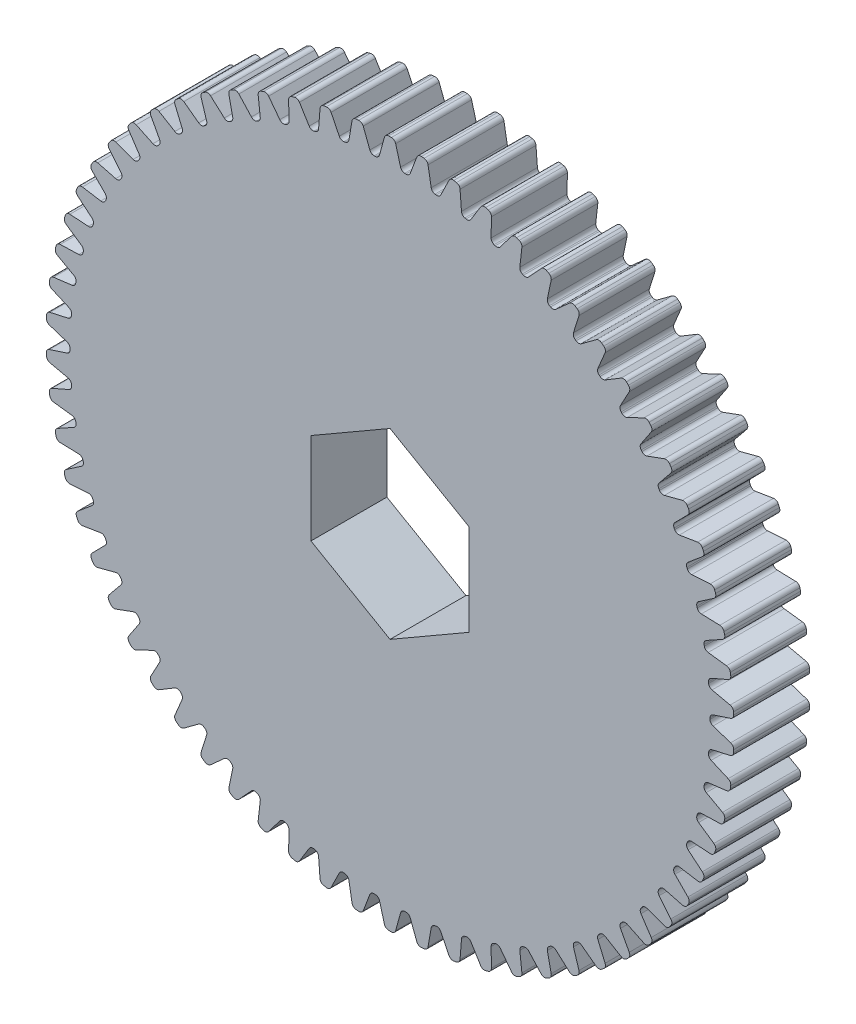
from build123d import *

# Parameters (mm, degrees)
SKETCH2_R           = 25.2838
BOSS_EXTRUDE1_DEPTH = 6
BOSS_EXTRUDE2_DEPTH = 6
CUT_EXTRUDE1_DEPTH  = 38.606243164
FILLET1_R           = 0.35
CIRPATTERN1_DEPTH   = 6


# Read off the part's stored shape, not the designer's step: CirPattern1
with BuildPart() as part:
    # Sketch2 → Boss-Extrude1 (new body)
    with BuildSketch(Plane.XY):
        Circle(SKETCH2_R)
    extrude(amount=BOSS_EXTRUDE1_DEPTH)

    # Sketch3 → Boss-Extrude2 (add)
    with BuildSketch(Plane.XY):
        with BuildLine():
            Line((-0.375, 27.181213318), (-0.9, 25.267776761))
            ThreePointArc((-0.9, 25.267776761), (0, 25.2838), (0.9, 25.267776761))
            Line((0.9, 25.267776761), (0.375, 27.181213318))
            ThreePointArc((0.375, 27.181213318), (0, 27.1838), (-0.375, 27.181213318))
        make_face()
    extrude(amount=BOSS_EXTRUDE2_DEPTH)

    # Sketch4 → Cut-Extrude1 (cut, through all)
    with BuildSketch(Plane(origin=(0, 0, 0), x_dir=(-1, 0, 0), z_dir=(0, 0, -1))):
        Polygon((-6.25, 3.608439182), (-6.25, -3.608439182), (0, -7.216878365), (6.25, -3.608439182), (6.25, 3.608439182), (0, 7.216878365), align=None)
    extrude(amount=-CUT_EXTRUDE1_DEPTH, mode=Mode.SUBTRACT)

    # Fillet1
    fillet1_edges = [part.edges().sort_by_distance(p)[0] for p in [
        (0.375, 27.181213318, 3),
        (-0.375, 27.181213318, 3),
        (-0.9, 25.267776761, 3),
        (0.9, 25.267776761, 3),
    ]]
    fillet(fillet1_edges, radius=FILLET1_R)

    # CirPattern1 outline → CirPattern1 (add)
    with BuildSketch(Plane.XY):
        with BuildLine():
            ThreePointArc((-3.25384677, 25.319836134), (-3.355117626, 25.128558814), (-3.549511796, 25.033407847))
            ThreePointArc((-3.549511796, 25.033407847), (-2.403377988, 25.169312996), (-1.252236092, 25.252771079))
            ThreePointArc((-1.252236092, 25.252771079), (-1.461124745, 25.309413206), (-1.596764976, 25.478068261))
            Line((-1.596764976, 25.478068261), (-2.116541162, 26.846566963))
            ThreePointArc((-2.116541162, 26.846566963), (-2.25832245, 27.019147159), (-2.475609779, 27.070839268))
            ThreePointArc((-2.475609779, 27.070839268), (-2.58398447, 27.060709649), (-2.692317732, 27.050146167))
            ThreePointArc((-2.692317732, 27.050146167), (-2.8958956, 26.958266305), (-3.002453698, 26.761972573))
            Line((-3.002453698, 26.761972573), (-3.25384677, 25.319836134))
        make_face()
        with BuildLine():
            ThreePointArc((-5.64591654, 24.895888157), (-5.728546768, 24.695850547), (-5.913016032, 24.582652091))
            ThreePointArc((-5.913016032, 24.582652091), (-4.784990612, 24.826888796), (-3.646994371, 25.019391969))
            ThreePointArc((-3.646994371, 25.019391969), (-3.860321336, 25.055921486), (-4.01137906, 25.210919434))
            Line((-4.01137906, 25.210919434), (-4.658885732, 26.523813601))
            ThreePointArc((-4.658885732, 26.523813601), (-4.816429813, 26.682135172), (-5.037646896, 26.712938741))
            ThreePointArc((-5.037646896, 26.712938741), (-5.144567976, 26.692553321), (-5.251406574, 26.67173994))
            ThreePointArc((-5.251406574, 26.67173994), (-5.44532889, 26.56092481), (-5.532745579, 26.35539092))
            Line((-5.532745579, 26.35539092), (-5.64591654, 24.895888157))
        make_face()
        with BuildLine():
            ThreePointArc((-7.986856015, 24.24647916), (-8.050097304, 24.039492834), (-8.222971079, 23.909272031))
            ThreePointArc((-8.222971079, 23.909272031), (-7.123269621, 24.259628446), (-6.008724905, 24.55943337))
            ThreePointArc((-6.008724905, 24.55943337), (-6.224558261, 24.575519461), (-6.389665475, 24.715456617))
            Line((-6.389665475, 24.715456617), (-7.159038711, 25.960856475))
            ThreePointArc((-7.159038711, 25.960856475), (-7.330918843, 26.103485638), (-7.554062303, 26.113121705))
            ThreePointArc((-7.554062303, 26.113121705), (-7.658561479, 26.082665096), (-7.762937865, 26.051790306))
            ThreePointArc((-7.762937865, 26.051790306), (-7.945448438, 25.923043468), (-8.01293206, 25.710130766))
            Line((-8.01293206, 25.710130766), (-7.986856015, 24.24647916))
        make_face()
        with BuildLine():
            ThreePointArc((-10.255465286, 23.377490294), (-10.298744912, 23.165429751), (-10.458457627, 23.019365901))
            ThreePointArc((-10.458457627, 23.019365901), (-9.397039196, 23.472669145), (-8.316039495, 23.877060739))
            ThreePointArc((-8.316039495, 23.877060739), (-8.532424621, 23.872557727), (-8.710086089, 23.996166798))
            Line((-8.710086089, 23.996166798), (-9.594358326, 25.162793814))
            ThreePointArc((-9.594358326, 25.162793814), (-9.779017935, 25.288438895), (-10.002066951, 25.276820194))
            ThreePointArc((-10.002066951, 25.276820194), (-10.103197862, 25.236568218), (-10.204166789, 25.195911624))
            ThreePointArc((-10.204166789, 25.195911624), (-10.373612775, 25.050399029), (-10.420552186, 24.832035686))
            Line((-10.420552186, 24.832035686), (-10.255465286, 23.377490294))
        make_face()
        with BuildLine():
            ThreePointArc((-12.431199475, 22.296791256), (-12.454125491, 22.08157695), (-12.599230763, 21.920992829))
            ThreePointArc((-12.599230763, 21.920992829), (-11.58570773, 22.473137716), (-10.548042744, 22.978453749))
            ThreePointArc((-10.548042744, 22.978453749), (-10.763020022, 22.953402413), (-10.951626815, 23.059563976))
            Line((-10.951626815, 23.059563976), (-11.942789948, 24.136852994))
            ThreePointArc((-11.942789948, 24.136852994), (-12.138556728, 24.244376133), (-12.359491333, 24.211607886))
            ThreePointArc((-12.359491333, 24.211607886), (-12.456338121, 24.161925069), (-12.552985198, 24.111854865))
            ThreePointArc((-12.552985198, 24.111854865), (-12.707832068, 23.950894297), (-12.733802179, 23.729057846))
            Line((-12.733802179, 23.729057846), (-12.431199475, 22.296791256))
        make_face()
        with BuildLine():
            ThreePointArc((-14.494354796, 21.014169023), (-14.496719581, 20.797749967), (-14.625903315, 20.624099851))
            ThreePointArc((-14.625903315, 20.624099851), (-13.669454301, 21.270086073), (-12.684521285, 21.871750323))
            ThreePointArc((-12.684521285, 21.871750323), (-12.896143849, 21.826377532), (-13.093987913, 21.914130172))
            Line((-13.093987913, 21.914130172), (-14.183065813, 22.892325097))
            ThreePointArc((-14.183065813, 22.892325097), (-14.388166871, 22.980752547), (-14.604986247, 22.927131508))
            ThreePointArc((-14.604986247, 22.927131508), (-14.696671854, 22.868467786), (-14.78812183, 22.809437415))
            ThreePointArc((-14.78812183, 22.809437415), (-14.926967266, 22.634486558), (-14.931732887, 22.411185984))
            Line((-14.931732887, 22.411185984), (-14.494354796, 21.014169023))
        make_face()
        with BuildLine():
            ThreePointArc((-16.426246996, 19.541239221), (-16.408029134, 19.325575341), (-16.52012142, 19.140431831))
            ThreePointArc((-16.52012142, 19.140431831), (-15.629408176, 19.874409237), (-14.706126836, 20.56697294))
            ThreePointArc((-14.706126836, 20.56697294), (-14.912478199, 20.501689596), (-15.117767829, 20.570238612))
            Line((-15.117767829, 20.570238612), (-16.294897639, 21.440480758))
            ThreePointArc((-16.294897639, 21.440480758), (-16.507475547, 21.509011707), (-16.718216144, 21.435023476))
            ThreePointArc((-16.718216144, 21.435023476), (-16.80391025, 21.367910117), (-16.88933494, 21.300454167))
            ThreePointArc((-16.88933494, 21.300454167), (-17.010921537, 21.113097404), (-16.99443951, 20.890354951))
            Line((-16.99443951, 20.890354951), (-16.426246996, 19.541239221))
        make_face()
        with BuildLine():
            ThreePointArc((-18.209380559, 17.891340931), (-18.170745034, 17.678385311), (-18.264730749, 17.483425097))
            ThreePointArc((-18.264730749, 17.483425097), (-17.44781971, 18.298746672), (-16.594551425, 19.075937865))
            ThreePointArc((-16.594551425, 19.075937865), (-16.793762837, 18.991335185), (-17.004638898, 19.040059786))
            Line((-17.004638898, 19.040059786), (-18.259160348, 19.794468106))
            ThreePointArc((-18.259160348, 19.794468106), (-18.477289967, 19.842481926), (-18.680043286, 19.748796552))
            ThreePointArc((-18.680043286, 19.748796552), (-18.758969832, 19.673841345), (-18.837595617, 19.598570708))
            ThreePointArc((-18.837595617, 19.598570708), (-18.940822268, 19.400504769), (-18.903241856, 19.180337628))
            Line((-18.903241856, 19.180337628), (-18.209380559, 17.891340931))
        make_face()
        with BuildLine():
            ThreePointArc((-19.827607153, 16.079415887), (-19.768903854, 15.871097087), (-19.843931847, 15.668085757))
            ThreePointArc((-19.843931847, 15.668085757), (-19.108221088, 16.557367825), (-18.332693187, 17.412148142))
            ThreePointArc((-18.332693187, 17.412148142), (-18.522960558, 17.308992302), (-18.737513324, 17.337451229))
            Line((-18.737513324, 17.337451229), (-20.058065274, 17.969193685))
            ThreePointArc((-20.058065274, 17.969193685), (-20.279771189, 17.996255556), (-20.472701064, 17.883721469))
            ThreePointArc((-20.472701064, 17.883721469), (-20.544145279, 17.801603219), (-20.615260112, 17.719199558))
            ThreePointArc((-20.615260112, 17.719199558), (-20.69919198, 17.51221816), (-20.640853518, 17.296620198))
            Line((-20.640853518, 17.296620198), (-19.827607153, 16.079415887))
        make_face()
        with BuildLine():
            ThreePointArc((-21.266271865, 14.121873163), (-21.188032418, 13.92007775), (-21.243423225, 13.710853807))
            ThreePointArc((-21.243423225, 13.710853807), (-20.595575456, 14.66604289), (-19.904811241, 15.59067131))
            ThreePointArc((-19.904811241, 15.59067131), (-20.08441148, 15.469896503), (-20.300697927, 15.47783203))
            Line((-20.300697927, 15.47783203), (-21.675321254, 15.981187463))
            ThreePointArc((-21.675321254, 15.981187463), (-21.898595662, 15.987052309), (-22.079954891, 15.856688635))
            ThreePointArc((-22.079954891, 15.856688635), (-22.143269765, 15.768151018), (-22.206229618, 15.679360592))
            ThreePointArc((-22.206229618, 15.679360592), (-22.270106604, 15.465338191), (-22.191538413, 15.256261896))
            Line((-22.191538413, 15.256261896), (-21.266271865, 14.121873163))
        make_face()
        with BuildLine():
            ThreePointArc((-22.512345926, 12.036440569), (-22.41527888, 11.842996033), (-22.450530873, 11.629454241))
            ThreePointArc((-22.450530873, 11.629454241), (-21.896413104, 12.6419), (-21.296668242, 13.628002944))
            ThreePointArc((-21.296668242, 13.628002944), (-21.463974862, 13.490702927), (-21.680036267, 13.478043187))
            Line((-21.680036267, 13.478043187), (-23.096282169, 13.848453133))
            ThreePointArc((-23.096282169, 13.848453133), (-23.319103062, 13.833067841), (-23.487249227, 13.686055172))
            ThreePointArc((-23.487249227, 13.686055172), (-23.541861371, 13.5919), (-23.59609607, 13.49752691))
            ThreePointArc((-23.59609607, 13.49752691), (-23.639339694, 13.278401725), (-23.541253301, 13.077740525))
            Line((-23.541253301, 13.077740525), (-22.512345926, 12.036440569))
        make_face()
        with BuildLine():
            ThreePointArc((-23.554544697, 9.842004105), (-23.439529106, 9.65866231), (-23.454323037, 9.442736537))
            ThreePointArc((-23.454323037, 9.442736537), (-22.998953444, 10.503270106), (-22.495659317, 11.541917273))
            ThreePointArc((-22.495659317, 11.541917273), (-22.649157163, 11.389335455), (-22.863036841, 11.356195097))
            Line((-22.863036841, 11.356195097), (-24.308079576, 11.590305067))
            ThreePointArc((-24.308079576, 11.590305067), (-24.528429054, 11.553808968), (-24.681839397, 11.391478675))
            ThreePointArc((-24.681839397, 11.391478675), (-24.727254235, 11.29255863), (-24.772272623, 11.193457533))
            ThreePointArc((-24.772272623, 11.193457533), (-24.794491262, 10.971213996), (-24.677774953, 10.78078511))
            Line((-24.677774953, 10.78078511), (-23.554544697, 9.842004105))
        make_face()
        with BuildLine():
            ThreePointArc((-24.383429863, 7.558436927), (-24.251507326, 7.386858246), (-24.24570922, 7.170503949))
            ThreePointArc((-24.24570922, 7.170503949), (-23.8932117, 8.269520971), (-23.490926218, 9.351306211))
            ThreePointArc((-23.490926218, 9.351306211), (-23.629225191, 9.184824399), (-23.838986213, 9.131503547))
            Line((-23.838986213, 9.131503547), (-25.29973925, 9.227193403))
            ThreePointArc((-25.29973925, 9.227193403), (-25.515621793, 9.169917012), (-25.652907008, 8.993739183))
            ThreePointArc((-25.652907008, 8.993739183), (-25.688713256, 8.890950101), (-25.724107638, 8.788018471))
            ThreePointArc((-25.724107638, 8.788018471), (-25.725100079, 8.564669254), (-25.590810853, 8.386197236))
            Line((-25.590810853, 8.386197236), (-24.383429863, 7.558436927))
        make_face()
        with BuildLine():
            ThreePointArc((-24.991494913, 5.206419375), (-24.84386014, 5.048157649), (-24.817522505, 4.833334166))
            ThreePointArc((-24.817522505, 4.833334166), (-24.571089331, 5.960881773), (-24.273455653, 7.076008273))
            ThreePointArc((-24.273455653, 7.076008273), (-24.395303295, 6.89713415), (-24.599046034, 6.824115686))
            Line((-24.599046034, 6.824115686), (-26.062280567, 6.780518848))
            ThreePointArc((-26.062280567, 6.780518848), (-26.271741111, 6.702980868), (-26.39165792, 6.514550996))
            ThreePointArc((-26.39165792, 6.514550996), (-26.417531311, 6.408823751), (-26.442981152, 6.302993753))
            ThreePointArc((-26.442981152, 6.302993753), (-26.422738406, 6.080561542), (-26.272092408, 5.915662661))
            Line((-26.272092408, 5.915662661), (-24.991494913, 5.206419375))
        make_face()
        with BuildLine():
            ThreePointArc((-25.373233114, 2.807251682), (-25.21122311, 2.663740155), (-25.164584463, 2.452392961))
            ThreePointArc((-25.164584463, 2.452392961), (-25.026447372, 3.598259908), (-24.836160915, 4.736628908))
            ThreePointArc((-24.836160915, 4.736628908), (-24.940453755, 4.546982386), (-25.136333085, 4.454927577))
            Line((-25.136333085, 4.454927577), (-26.588797836, 4.272438863))
            ThreePointArc((-26.588797836, 4.272438863), (-26.789939473, 4.175341491), (-26.891401891, 3.976366027))
            ThreePointArc((-26.891401891, 3.976366027), (-26.907108112, 3.8686581), (-26.922382933, 3.760888148))
            ThreePointArc((-26.922382933, 3.760888148), (-26.881088321, 3.541387322), (-26.715449825, 3.391554928))
            Line((-26.715449825, 3.391554928), (-25.373233114, 2.807251682))
        make_face()
        with BuildLine():
            ThreePointArc((-25.525187388, 0.382661083), (-25.35026934, 0.255199417), (-25.283752048, 0.049242505))
            ThreePointArc((-25.283752048, 0.049242505), (-25.25516203, 1.203051643), (-25.173946058, 2.354353898))
            ThreePointArc((-25.173946058, 2.354353898), (-25.259739604, 2.155652445), (-25.445981611, 2.045394953))
            Line((-25.445981611, 2.045394953), (-26.874522834, 1.725667011))
            ThreePointArc((-26.874522834, 1.725667011), (-27.065523994, 1.609889575), (-27.147613162, 1.402170471))
            ThreePointArc((-27.147613162, 1.402170471), (-27.153009975, 1.293457283), (-27.157971445, 1.184723358))
            ThreePointArc((-27.157971445, 1.184723358), (-27.095998939, 0.970141751), (-26.916867992, 0.83673275))
            Line((-26.916867992, 0.83673275), (-25.525187388, 0.382661083))
        make_face()
        with BuildLine():
            ThreePointArc((-25.445981611, -2.045394953), (-25.259739604, -2.155652445), (-25.173946059, -2.354353898))
            ThreePointArc((-25.173946059, -2.354353898), (-25.25516203, -1.203051643), (-25.283752048, -0.049242505))
            ThreePointArc((-25.283752048, -0.049242505), (-25.35026934, -0.255199417), (-25.525187388, -0.382661083))
            Line((-25.525187388, -0.382661083), (-26.916867992, -0.83673275))
            ThreePointArc((-26.916867992, -0.83673275), (-27.095998939, -0.970141751), (-27.157971445, -1.184723358))
            ThreePointArc((-27.157971445, -1.184723358), (-27.153009975, -1.293457283), (-27.147613162, -1.402170471))
            ThreePointArc((-27.147613162, -1.402170471), (-27.065523994, -1.609889575), (-26.874522834, -1.725667011))
            Line((-26.874522834, -1.725667011), (-25.445981611, -2.045394953))
        make_face()
        with BuildLine():
            ThreePointArc((-25.136333085, -4.454927577), (-24.940453755, -4.546982386), (-24.836160916, -4.736628908))
            ThreePointArc((-24.836160916, -4.736628908), (-25.026447372, -3.598259908), (-25.164584463, -2.452392961))
            ThreePointArc((-25.164584463, -2.452392961), (-25.21122311, -2.663740155), (-25.373233114, -2.807251682))
            Line((-25.373233114, -2.807251682), (-26.715449825, -3.391554928))
            ThreePointArc((-26.715449825, -3.391554928), (-26.881088321, -3.541387322), (-26.922382933, -3.760888148))
            ThreePointArc((-26.922382933, -3.760888148), (-26.907108112, -3.8686581), (-26.891401891, -3.976366027))
            ThreePointArc((-26.891401891, -3.976366027), (-26.789939473, -4.175341491), (-26.588797836, -4.272438863))
            Line((-26.588797836, -4.272438863), (-25.136333085, -4.454927577))
        make_face()
        with BuildLine():
            ThreePointArc((-24.599046034, -6.824115686), (-24.395303295, -6.89713415), (-24.273455653, -7.076008273))
            ThreePointArc((-24.273455653, -7.076008273), (-24.571089331, -5.960881773), (-24.817522505, -4.833334166))
            ThreePointArc((-24.817522505, -4.833334166), (-24.84386014, -5.048157649), (-24.991494913, -5.206419375))
            Line((-24.991494913, -5.206419375), (-26.272092408, -5.915662661))
            ThreePointArc((-26.272092408, -5.915662661), (-26.422738406, -6.080561542), (-26.442981152, -6.302993753))
            ThreePointArc((-26.442981152, -6.302993753), (-26.417531311, -6.408823751), (-26.39165792, -6.514550996))
            ThreePointArc((-26.39165792, -6.514550996), (-26.271741111, -6.702980868), (-26.062280567, -6.780518848))
            Line((-26.062280567, -6.780518848), (-24.599046034, -6.824115686))
        make_face()
        with BuildLine():
            ThreePointArc((-23.838986213, -9.131503547), (-23.629225191, -9.184824399), (-23.490926218, -9.351306211))
            ThreePointArc((-23.490926218, -9.351306211), (-23.8932117, -8.269520971), (-24.245709219, -7.170503949))
            ThreePointArc((-24.245709219, -7.170503949), (-24.251507326, -7.386858246), (-24.383429863, -7.558436927))
            Line((-24.383429863, -7.558436927), (-25.590810853, -8.386197236))
            ThreePointArc((-25.590810853, -8.386197236), (-25.725100079, -8.564669254), (-25.724107638, -8.788018471))
            ThreePointArc((-25.724107638, -8.788018471), (-25.688713256, -8.890950101), (-25.652907008, -8.993739183))
            ThreePointArc((-25.652907008, -8.993739183), (-25.515621793, -9.169917012), (-25.29973925, -9.227193403))
            Line((-25.29973925, -9.227193403), (-23.838986213, -9.131503547))
        make_face()
        with BuildLine():
            ThreePointArc((-22.863036841, -11.356195097), (-22.649157163, -11.389335455), (-22.495659317, -11.541917273))
            ThreePointArc((-22.495659317, -11.541917273), (-22.998953444, -10.503270106), (-23.454323037, -9.442736537))
            ThreePointArc((-23.454323037, -9.442736537), (-23.439529106, -9.65866231), (-23.554544697, -9.842004105))
            Line((-23.554544697, -9.842004105), (-24.677774953, -10.78078511))
            ThreePointArc((-24.677774953, -10.78078511), (-24.794491262, -10.971213996), (-24.772272623, -11.193457533))
            ThreePointArc((-24.772272623, -11.193457533), (-24.727254235, -11.29255863), (-24.681839397, -11.391478675))
            ThreePointArc((-24.681839397, -11.391478675), (-24.528429054, -11.553808968), (-24.308079576, -11.590305067))
            Line((-24.308079576, -11.590305067), (-22.863036841, -11.356195097))
        make_face()
        with BuildLine():
            ThreePointArc((-21.680036267, -13.478043187), (-21.463974862, -13.490702927), (-21.296668242, -13.628002944))
            ThreePointArc((-21.296668242, -13.628002944), (-21.896413104, -12.6419), (-22.450530873, -11.629454241))
            ThreePointArc((-22.450530873, -11.629454241), (-22.41527888, -11.842996033), (-22.512345926, -12.036440569))
            Line((-22.512345926, -12.036440569), (-23.541253301, -13.077740525))
            ThreePointArc((-23.541253301, -13.077740525), (-23.639339694, -13.278401725), (-23.59609607, -13.49752691))
            ThreePointArc((-23.59609607, -13.49752691), (-23.541861371, -13.5919), (-23.487249227, -13.686055172))
            ThreePointArc((-23.487249227, -13.686055172), (-23.319103062, -13.833067841), (-23.096282169, -13.848453133))
            Line((-23.096282169, -13.848453133), (-21.680036267, -13.478043187))
        make_face()
        with BuildLine():
            ThreePointArc((-20.300697927, -15.47783203), (-20.08441148, -15.469896503), (-19.904811241, -15.59067131))
            ThreePointArc((-19.904811241, -15.59067131), (-20.595575456, -14.66604289), (-21.243423225, -13.710853807))
            ThreePointArc((-21.243423225, -13.710853807), (-21.188032418, -13.92007775), (-21.266271865, -14.121873163))
            Line((-21.266271865, -14.121873163), (-22.191538413, -15.256261896))
            ThreePointArc((-22.191538413, -15.256261896), (-22.270106604, -15.465338191), (-22.206229618, -15.679360592))
            ThreePointArc((-22.206229618, -15.679360592), (-22.143269765, -15.768151018), (-22.079954891, -15.856688635))
            ThreePointArc((-22.079954891, -15.856688635), (-21.898595662, -15.987052309), (-21.675321254, -15.981187463))
            Line((-21.675321254, -15.981187463), (-20.300697927, -15.47783203))
        make_face()
        with BuildLine():
            ThreePointArc((-18.737513324, -17.337451229), (-18.522960558, -17.308992302), (-18.332693187, -17.412148142))
            ThreePointArc((-18.332693187, -17.412148142), (-19.108221088, -16.557367825), (-19.843931847, -15.668085757))
            ThreePointArc((-19.843931847, -15.668085757), (-19.768903854, -15.871097087), (-19.827607153, -16.079415887))
            Line((-19.827607153, -16.079415887), (-20.640853518, -17.296620198))
            ThreePointArc((-20.640853518, -17.296620198), (-20.69919198, -17.51221816), (-20.615260112, -17.719199558))
            ThreePointArc((-20.615260112, -17.719199558), (-20.544145279, -17.801603219), (-20.472701064, -17.883721469))
            ThreePointArc((-20.472701064, -17.883721469), (-20.279771189, -17.996255556), (-20.058065274, -17.969193685))
            Line((-20.058065274, -17.969193685), (-18.737513324, -17.337451229))
        make_face()
        with BuildLine():
            ThreePointArc((-17.004638898, -19.040059786), (-16.793762837, -18.991335185), (-16.594551425, -19.075937865))
            ThreePointArc((-16.594551425, -19.075937865), (-17.44781971, -18.298746673), (-18.264730749, -17.483425097))
            ThreePointArc((-18.264730749, -17.483425097), (-18.170745034, -17.678385311), (-18.209380559, -17.891340931))
            Line((-18.209380559, -17.891340931), (-18.903241856, -19.180337628))
            ThreePointArc((-18.903241856, -19.180337628), (-18.940822268, -19.400504769), (-18.837595617, -19.598570708))
            ThreePointArc((-18.837595617, -19.598570708), (-18.758969832, -19.673841345), (-18.680043286, -19.748796552))
            ThreePointArc((-18.680043286, -19.748796552), (-18.477289967, -19.842481926), (-18.259160348, -19.794468106))
            Line((-18.259160348, -19.794468106), (-17.004638898, -19.040059786))
        make_face()
        with BuildLine():
            ThreePointArc((-15.117767829, -20.570238612), (-14.912478199, -20.501689596), (-14.706126836, -20.56697294))
            ThreePointArc((-14.706126836, -20.56697294), (-15.629408176, -19.874409237), (-16.52012142, -19.140431831))
            ThreePointArc((-16.52012142, -19.140431831), (-16.408029134, -19.325575341), (-16.426246996, -19.541239221))
            Line((-16.426246996, -19.541239221), (-16.99443951, -20.890354951))
            ThreePointArc((-16.99443951, -20.890354951), (-17.010921537, -21.113097404), (-16.88933494, -21.300454167))
            ThreePointArc((-16.88933494, -21.300454167), (-16.80391025, -21.367910117), (-16.718216144, -21.435023476))
            ThreePointArc((-16.718216144, -21.435023476), (-16.507475547, -21.509011707), (-16.294897639, -21.440480758))
            Line((-16.294897639, -21.440480758), (-15.117767829, -20.570238612))
        make_face()
        with BuildLine():
            ThreePointArc((-13.093987913, -21.914130172), (-12.896143849, -21.826377532), (-12.684521285, -21.871750324))
            ThreePointArc((-12.684521285, -21.871750324), (-13.669454301, -21.270086073), (-14.625903315, -20.624099851))
            ThreePointArc((-14.625903315, -20.624099851), (-14.496719581, -20.797749967), (-14.494354796, -21.014169023))
            Line((-14.494354796, -21.014169023), (-14.931732887, -22.411185984))
            ThreePointArc((-14.931732887, -22.411185984), (-14.926967266, -22.634486558), (-14.78812183, -22.809437415))
            ThreePointArc((-14.78812183, -22.809437415), (-14.696671854, -22.868467786), (-14.604986247, -22.927131508))
            ThreePointArc((-14.604986247, -22.927131508), (-14.388166871, -22.980752547), (-14.183065813, -22.892325097))
            Line((-14.183065813, -22.892325097), (-13.093987913, -21.914130172))
        make_face()
        with BuildLine():
            ThreePointArc((-10.951626815, -23.059563976), (-10.763020022, -22.953402413), (-10.548042744, -22.978453749))
            ThreePointArc((-10.548042744, -22.978453749), (-11.58570773, -22.473137717), (-12.599230763, -21.920992829))
            ThreePointArc((-12.599230763, -21.920992829), (-12.454125491, -22.08157695), (-12.431199475, -22.296791256))
            Line((-12.431199475, -22.296791256), (-12.733802179, -23.729057846))
            ThreePointArc((-12.733802179, -23.729057846), (-12.707832068, -23.950894297), (-12.552985198, -24.111854865))
            ThreePointArc((-12.552985198, -24.111854865), (-12.456338121, -24.161925069), (-12.359491333, -24.211607886))
            ThreePointArc((-12.359491333, -24.211607886), (-12.138556728, -24.244376133), (-11.942789948, -24.136852994))
            Line((-11.942789948, -24.136852994), (-10.951626815, -23.059563976))
        make_face()
        with BuildLine():
            ThreePointArc((-8.710086089, -23.996166798), (-8.532424621, -23.872557727), (-8.316039495, -23.877060739))
            ThreePointArc((-8.316039495, -23.877060739), (-9.397039196, -23.472669145), (-10.458457627, -23.019365901))
            ThreePointArc((-10.458457627, -23.019365901), (-10.298744912, -23.165429751), (-10.255465286, -23.377490294))
            Line((-10.255465286, -23.377490294), (-10.420552186, -24.832035686))
            ThreePointArc((-10.420552186, -24.832035686), (-10.373612775, -25.050399029), (-10.204166789, -25.195911624))
            ThreePointArc((-10.204166789, -25.195911624), (-10.103197862, -25.236568218), (-10.002066951, -25.276820194))
            ThreePointArc((-10.002066951, -25.276820194), (-9.779017935, -25.288438895), (-9.594358326, -25.162793814))
            Line((-9.594358326, -25.162793814), (-8.710086089, -23.996166798))
        make_face()
        with BuildLine():
            ThreePointArc((-6.389665475, -24.715456617), (-6.224558261, -24.575519461), (-6.008724905, -24.55943337))
            ThreePointArc((-6.008724905, -24.55943337), (-7.123269621, -24.259628446), (-8.222971079, -23.909272031))
            ThreePointArc((-8.222971079, -23.909272031), (-8.050097304, -24.039492834), (-7.986856015, -24.24647916))
            Line((-7.986856015, -24.24647916), (-8.01293206, -25.710130766))
            ThreePointArc((-8.01293206, -25.710130766), (-7.945448438, -25.923043468), (-7.762937865, -26.051790306))
            ThreePointArc((-7.762937865, -26.051790306), (-7.658561479, -26.082665096), (-7.554062303, -26.113121705))
            ThreePointArc((-7.554062303, -26.113121705), (-7.330918843, -26.103485638), (-7.159038711, -25.960856475))
            Line((-7.159038711, -25.960856475), (-6.389665475, -24.715456617))
        make_face()
        with BuildLine():
            ThreePointArc((-4.01137906, -25.210919434), (-3.860321336, -25.055921486), (-3.646994371, -25.019391969))
            ThreePointArc((-3.646994371, -25.019391969), (-4.784990612, -24.826888796), (-5.913016032, -24.582652091))
            ThreePointArc((-5.913016032, -24.582652091), (-5.728546768, -24.695850547), (-5.64591654, -24.895888157))
            Line((-5.64591654, -24.895888157), (-5.532745579, -26.35539092))
            ThreePointArc((-5.532745579, -26.35539092), (-5.44532889, -26.56092481), (-5.251406574, -26.67173994))
            ThreePointArc((-5.251406574, -26.67173994), (-5.144567976, -26.692553321), (-5.037646896, -26.712938741))
            ThreePointArc((-5.037646896, -26.712938741), (-4.816429813, -26.682135172), (-4.658885732, -26.523813601))
            Line((-4.658885732, -26.523813601), (-4.01137906, -25.210919434))
        make_face()
        with BuildLine():
            ThreePointArc((-1.596764976, -25.478068261), (-1.461124745, -25.309413206), (-1.252236092, -25.25277108))
            ThreePointArc((-1.252236092, -25.25277108), (-2.403377988, -25.169312996), (-3.549511796, -25.033407847))
            ThreePointArc((-3.549511796, -25.033407847), (-3.355117626, -25.128558814), (-3.25384677, -25.319836134))
            Line((-3.25384677, -25.319836134), (-3.002453698, -26.761972573))
            ThreePointArc((-3.002453698, -26.761972573), (-2.8958956, -26.958266305), (-2.692317732, -27.050146167))
            ThreePointArc((-2.692317732, -27.050146167), (-2.58398447, -27.060709649), (-2.475609779, -27.070839268))
            ThreePointArc((-2.475609779, -27.070839268), (-2.25832245, -27.019147159), (-2.116541162, -26.846566963))
            Line((-2.116541162, -26.846566963), (-1.596764976, -25.478068261))
        make_face()
        with BuildLine():
            ThreePointArc((0.832309659, -25.514483755), (0.951304019, -25.33369896), (1.153862631, -25.257457185))
            ThreePointArc((1.153862631, -25.257457185), (0, -25.2838), (-1.153862631, -25.257457185))
            ThreePointArc((-1.153862631, -25.257457185), (-0.951304019, -25.33369896), (-0.832309659, -25.514483755))
            Line((-0.832309659, -25.514483755), (-0.444971132, -26.926193658))
            ThreePointArc((-0.444971132, -26.926193658), (-0.320236632, -27.111469566), (-0.108846843, -27.183582082))
            ThreePointArc((-0.108846843, -27.183582082), (0, -27.1838), (0.108846843, -27.183582082))
            ThreePointArc((0.108846843, -27.183582082), (0.320236632, -27.111469566), (0.444971132, -26.926193658))
            Line((0.444971132, -26.926193658), (0.832309659, -25.514483755))
        make_face()
        with BuildLine():
            ThreePointArc((3.25384677, -25.319836134), (3.355117626, -25.128558814), (3.549511796, -25.033407847))
            ThreePointArc((3.549511796, -25.033407847), (2.403377988, -25.169312996), (1.252236092, -25.25277108))
            ThreePointArc((1.252236092, -25.25277108), (1.461124745, -25.309413206), (1.596764976, -25.478068261))
            Line((1.596764976, -25.478068261), (2.116541162, -26.846566963))
            ThreePointArc((2.116541162, -26.846566963), (2.25832245, -27.019147159), (2.475609779, -27.070839268))
            ThreePointArc((2.475609779, -27.070839268), (2.58398447, -27.060709649), (2.692317732, -27.050146167))
            ThreePointArc((2.692317732, -27.050146167), (2.8958956, -26.958266305), (3.002453698, -26.761972573))
            Line((3.002453698, -26.761972573), (3.25384677, -25.319836134))
        make_face()
        with BuildLine():
            ThreePointArc((5.64591654, -24.895888157), (5.728546768, -24.695850547), (5.913016032, -24.582652091))
            ThreePointArc((5.913016032, -24.582652091), (4.784990612, -24.826888796), (3.646994371, -25.019391969))
            ThreePointArc((3.646994371, -25.019391969), (3.860321336, -25.055921486), (4.01137906, -25.210919434))
            Line((4.01137906, -25.210919434), (4.658885732, -26.523813601))
            ThreePointArc((4.658885732, -26.523813601), (4.816429813, -26.682135172), (5.037646896, -26.712938741))
            ThreePointArc((5.037646896, -26.712938741), (5.144567976, -26.692553321), (5.251406574, -26.67173994))
            ThreePointArc((5.251406574, -26.67173994), (5.44532889, -26.56092481), (5.532745579, -26.35539092))
            Line((5.532745579, -26.35539092), (5.64591654, -24.895888157))
        make_face()
        with BuildLine():
            ThreePointArc((7.986856015, -24.24647916), (8.050097304, -24.039492834), (8.222971079, -23.909272031))
            ThreePointArc((8.222971079, -23.909272031), (7.123269621, -24.259628446), (6.008724905, -24.55943337))
            ThreePointArc((6.008724905, -24.55943337), (6.224558261, -24.575519461), (6.389665475, -24.715456617))
            Line((6.389665475, -24.715456617), (7.159038711, -25.960856475))
            ThreePointArc((7.159038711, -25.960856475), (7.330918843, -26.103485638), (7.554062303, -26.113121705))
            ThreePointArc((7.554062303, -26.113121705), (7.658561479, -26.082665096), (7.762937865, -26.051790306))
            ThreePointArc((7.762937865, -26.051790306), (7.945448438, -25.923043468), (8.01293206, -25.710130766))
            Line((8.01293206, -25.710130766), (7.986856015, -24.24647916))
        make_face()
        with BuildLine():
            ThreePointArc((10.255465286, -23.377490294), (10.298744912, -23.165429751), (10.458457627, -23.019365901))
            ThreePointArc((10.458457627, -23.019365901), (9.397039196, -23.472669145), (8.316039495, -23.877060739))
            ThreePointArc((8.316039495, -23.877060739), (8.532424621, -23.872557727), (8.710086089, -23.996166798))
            Line((8.710086089, -23.996166798), (9.594358326, -25.162793814))
            ThreePointArc((9.594358326, -25.162793814), (9.779017935, -25.288438895), (10.002066951, -25.276820194))
            ThreePointArc((10.002066951, -25.276820194), (10.103197862, -25.236568218), (10.204166789, -25.195911624))
            ThreePointArc((10.204166789, -25.195911624), (10.373612775, -25.050399029), (10.420552186, -24.832035686))
            Line((10.420552186, -24.832035686), (10.255465286, -23.377490294))
        make_face()
        with BuildLine():
            ThreePointArc((12.431199475, -22.296791256), (12.454125491, -22.08157695), (12.599230763, -21.920992829))
            ThreePointArc((12.599230763, -21.920992829), (11.58570773, -22.473137717), (10.548042744, -22.978453749))
            ThreePointArc((10.548042744, -22.978453749), (10.763020022, -22.953402413), (10.951626815, -23.059563976))
            Line((10.951626815, -23.059563976), (11.942789948, -24.136852994))
            ThreePointArc((11.942789948, -24.136852994), (12.138556728, -24.244376133), (12.359491333, -24.211607886))
            ThreePointArc((12.359491333, -24.211607886), (12.456338121, -24.161925069), (12.552985198, -24.111854865))
            ThreePointArc((12.552985198, -24.111854865), (12.707832068, -23.950894297), (12.733802179, -23.729057846))
            Line((12.733802179, -23.729057846), (12.431199475, -22.296791256))
        make_face()
        with BuildLine():
            ThreePointArc((14.494354796, -21.014169023), (14.496719581, -20.797749967), (14.625903315, -20.624099851))
            ThreePointArc((14.625903315, -20.624099851), (13.669454301, -21.270086073), (12.684521285, -21.871750324))
            ThreePointArc((12.684521285, -21.871750324), (12.896143849, -21.826377532), (13.093987913, -21.914130172))
            Line((13.093987913, -21.914130172), (14.183065813, -22.892325097))
            ThreePointArc((14.183065813, -22.892325097), (14.388166871, -22.980752547), (14.604986247, -22.927131508))
            ThreePointArc((14.604986247, -22.927131508), (14.696671854, -22.868467786), (14.78812183, -22.809437415))
            ThreePointArc((14.78812183, -22.809437415), (14.926967266, -22.634486558), (14.931732887, -22.411185984))
            Line((14.931732887, -22.411185984), (14.494354796, -21.014169023))
        make_face()
        with BuildLine():
            ThreePointArc((16.426246996, -19.541239221), (16.408029134, -19.325575341), (16.52012142, -19.140431831))
            ThreePointArc((16.52012142, -19.140431831), (15.629408176, -19.874409237), (14.706126836, -20.56697294))
            ThreePointArc((14.706126836, -20.56697294), (14.912478199, -20.501689596), (15.117767829, -20.570238612))
            Line((15.117767829, -20.570238612), (16.294897639, -21.440480758))
            ThreePointArc((16.294897639, -21.440480758), (16.507475547, -21.509011707), (16.718216144, -21.435023476))
            ThreePointArc((16.718216144, -21.435023476), (16.80391025, -21.367910117), (16.88933494, -21.300454167))
            ThreePointArc((16.88933494, -21.300454167), (17.010921537, -21.113097404), (16.99443951, -20.890354951))
            Line((16.99443951, -20.890354951), (16.426246996, -19.541239221))
        make_face()
        with BuildLine():
            ThreePointArc((18.209380559, -17.891340931), (18.170745034, -17.678385311), (18.264730749, -17.483425097))
            ThreePointArc((18.264730749, -17.483425097), (17.44781971, -18.298746673), (16.594551425, -19.075937865))
            ThreePointArc((16.594551425, -19.075937865), (16.793762837, -18.991335185), (17.004638898, -19.040059786))
            Line((17.004638898, -19.040059786), (18.259160348, -19.794468106))
            ThreePointArc((18.259160348, -19.794468106), (18.477289967, -19.842481926), (18.680043286, -19.748796552))
            ThreePointArc((18.680043286, -19.748796552), (18.758969832, -19.673841345), (18.837595617, -19.598570708))
            ThreePointArc((18.837595617, -19.598570708), (18.940822268, -19.400504769), (18.903241856, -19.180337628))
            Line((18.903241856, -19.180337628), (18.209380559, -17.891340931))
        make_face()
        with BuildLine():
            ThreePointArc((19.827607153, -16.079415887), (19.768903854, -15.871097087), (19.843931847, -15.668085757))
            ThreePointArc((19.843931847, -15.668085757), (19.108221088, -16.557367825), (18.332693187, -17.412148142))
            ThreePointArc((18.332693187, -17.412148142), (18.522960558, -17.308992302), (18.737513324, -17.337451229))
            Line((18.737513324, -17.337451229), (20.058065274, -17.969193685))
            ThreePointArc((20.058065274, -17.969193685), (20.279771189, -17.996255556), (20.472701064, -17.883721469))
            ThreePointArc((20.472701064, -17.883721469), (20.544145279, -17.801603219), (20.615260112, -17.719199558))
            ThreePointArc((20.615260112, -17.719199558), (20.69919198, -17.51221816), (20.640853518, -17.296620198))
            Line((20.640853518, -17.296620198), (19.827607153, -16.079415887))
        make_face()
        with BuildLine():
            ThreePointArc((21.266271865, -14.121873163), (21.188032418, -13.92007775), (21.243423225, -13.710853807))
            ThreePointArc((21.243423225, -13.710853807), (20.595575456, -14.66604289), (19.904811241, -15.59067131))
            ThreePointArc((19.904811241, -15.59067131), (20.08441148, -15.469896503), (20.300697927, -15.47783203))
            Line((20.300697927, -15.47783203), (21.675321254, -15.981187463))
            ThreePointArc((21.675321254, -15.981187463), (21.898595662, -15.987052309), (22.079954891, -15.856688635))
            ThreePointArc((22.079954891, -15.856688635), (22.143269765, -15.768151018), (22.206229618, -15.679360592))
            ThreePointArc((22.206229618, -15.679360592), (22.270106604, -15.465338191), (22.191538413, -15.256261896))
            Line((22.191538413, -15.256261896), (21.266271865, -14.121873163))
        make_face()
        with BuildLine():
            ThreePointArc((22.512345926, -12.036440569), (22.41527888, -11.842996033), (22.450530873, -11.629454241))
            ThreePointArc((22.450530873, -11.629454241), (21.896413104, -12.6419), (21.296668242, -13.628002944))
            ThreePointArc((21.296668242, -13.628002944), (21.463974862, -13.490702927), (21.680036267, -13.478043187))
            Line((21.680036267, -13.478043187), (23.096282169, -13.848453133))
            ThreePointArc((23.096282169, -13.848453133), (23.319103062, -13.833067841), (23.487249227, -13.686055172))
            ThreePointArc((23.487249227, -13.686055172), (23.541861371, -13.5919), (23.59609607, -13.49752691))
            ThreePointArc((23.59609607, -13.49752691), (23.639339694, -13.278401725), (23.541253301, -13.077740525))
            Line((23.541253301, -13.077740525), (22.512345926, -12.036440569))
        make_face()
        with BuildLine():
            ThreePointArc((23.554544697, -9.842004105), (23.439529106, -9.65866231), (23.454323037, -9.442736537))
            ThreePointArc((23.454323037, -9.442736537), (22.998953444, -10.503270106), (22.495659317, -11.541917273))
            ThreePointArc((22.495659317, -11.541917273), (22.649157163, -11.389335455), (22.863036841, -11.356195097))
            Line((22.863036841, -11.356195097), (24.308079576, -11.590305067))
            ThreePointArc((24.308079576, -11.590305067), (24.528429054, -11.553808968), (24.681839397, -11.391478675))
            ThreePointArc((24.681839397, -11.391478675), (24.727254235, -11.29255863), (24.772272623, -11.193457533))
            ThreePointArc((24.772272623, -11.193457533), (24.794491262, -10.971213996), (24.677774953, -10.78078511))
            Line((24.677774953, -10.78078511), (23.554544697, -9.842004105))
        make_face()
        with BuildLine():
            ThreePointArc((24.383429863, -7.558436927), (24.251507326, -7.386858246), (24.24570922, -7.170503949))
            ThreePointArc((24.24570922, -7.170503949), (23.8932117, -8.269520971), (23.490926218, -9.351306211))
            ThreePointArc((23.490926218, -9.351306211), (23.629225191, -9.184824399), (23.838986213, -9.131503547))
            Line((23.838986213, -9.131503547), (25.29973925, -9.227193403))
            ThreePointArc((25.29973925, -9.227193403), (25.515621793, -9.169917012), (25.652907008, -8.993739183))
            ThreePointArc((25.652907008, -8.993739183), (25.688713256, -8.890950101), (25.724107638, -8.788018471))
            ThreePointArc((25.724107638, -8.788018471), (25.725100079, -8.564669254), (25.590810853, -8.386197236))
            Line((25.590810853, -8.386197236), (24.383429863, -7.558436927))
        make_face()
        with BuildLine():
            ThreePointArc((24.991494913, -5.206419375), (24.84386014, -5.048157649), (24.817522505, -4.833334166))
            ThreePointArc((24.817522505, -4.833334166), (24.571089331, -5.960881773), (24.273455653, -7.076008273))
            ThreePointArc((24.273455653, -7.076008273), (24.395303295, -6.89713415), (24.599046034, -6.824115686))
            Line((24.599046034, -6.824115686), (26.062280567, -6.780518848))
            ThreePointArc((26.062280567, -6.780518848), (26.271741111, -6.702980868), (26.39165792, -6.514550996))
            ThreePointArc((26.39165792, -6.514550996), (26.417531311, -6.408823751), (26.442981152, -6.302993753))
            ThreePointArc((26.442981152, -6.302993753), (26.422738406, -6.080561542), (26.272092408, -5.915662661))
            Line((26.272092408, -5.915662661), (24.991494913, -5.206419375))
        make_face()
        with BuildLine():
            ThreePointArc((25.373233114, -2.807251682), (25.21122311, -2.663740155), (25.164584463, -2.452392961))
            ThreePointArc((25.164584463, -2.452392961), (25.026447372, -3.598259908), (24.836160916, -4.736628908))
            ThreePointArc((24.836160916, -4.736628908), (24.940453755, -4.546982386), (25.136333085, -4.454927577))
            Line((25.136333085, -4.454927577), (26.588797836, -4.272438863))
            ThreePointArc((26.588797836, -4.272438863), (26.789939473, -4.175341491), (26.891401891, -3.976366027))
            ThreePointArc((26.891401891, -3.976366027), (26.907108112, -3.8686581), (26.922382933, -3.760888148))
            ThreePointArc((26.922382933, -3.760888148), (26.881088321, -3.541387322), (26.715449825, -3.391554928))
            Line((26.715449825, -3.391554928), (25.373233114, -2.807251682))
        make_face()
        with BuildLine():
            ThreePointArc((25.525187388, -0.382661083), (25.35026934, -0.255199417), (25.283752048, -0.049242505))
            ThreePointArc((25.283752048, -0.049242505), (25.25516203, -1.203051643), (25.173946058, -2.354353898))
            ThreePointArc((25.173946058, -2.354353898), (25.259739604, -2.155652445), (25.445981611, -2.045394953))
            Line((25.445981611, -2.045394953), (26.874522834, -1.725667011))
            ThreePointArc((26.874522834, -1.725667011), (27.065523994, -1.609889575), (27.147613162, -1.402170471))
            ThreePointArc((27.147613162, -1.402170471), (27.153009975, -1.293457283), (27.157971445, -1.184723358))
            ThreePointArc((27.157971445, -1.184723358), (27.095998939, -0.970141751), (26.916867992, -0.83673275))
            Line((26.916867992, -0.83673275), (25.525187388, -0.382661083))
        make_face()
        with BuildLine():
            ThreePointArc((25.445981611, 2.045394953), (25.259739604, 2.155652445), (25.173946059, 2.354353898))
            ThreePointArc((25.173946059, 2.354353898), (25.25516203, 1.203051643), (25.283752048, 0.049242505))
            ThreePointArc((25.283752048, 0.049242505), (25.35026934, 0.255199417), (25.525187388, 0.382661083))
            Line((25.525187388, 0.382661083), (26.916867992, 0.83673275))
            ThreePointArc((26.916867992, 0.83673275), (27.095998939, 0.970141751), (27.157971445, 1.184723358))
            ThreePointArc((27.157971445, 1.184723358), (27.153009975, 1.293457283), (27.147613162, 1.402170471))
            ThreePointArc((27.147613162, 1.402170471), (27.065523994, 1.609889575), (26.874522834, 1.725667011))
            Line((26.874522834, 1.725667011), (25.445981611, 2.045394953))
        make_face()
        with BuildLine():
            ThreePointArc((25.136333085, 4.454927577), (24.940453755, 4.546982386), (24.836160916, 4.736628908))
            ThreePointArc((24.836160916, 4.736628908), (25.026447372, 3.598259908), (25.164584463, 2.452392961))
            ThreePointArc((25.164584463, 2.452392961), (25.21122311, 2.663740155), (25.373233114, 2.807251682))
            Line((25.373233114, 2.807251682), (26.715449825, 3.391554928))
            ThreePointArc((26.715449825, 3.391554928), (26.881088321, 3.541387322), (26.922382933, 3.760888148))
            ThreePointArc((26.922382933, 3.760888148), (26.907108112, 3.8686581), (26.891401891, 3.976366027))
            ThreePointArc((26.891401891, 3.976366027), (26.789939473, 4.175341491), (26.588797836, 4.272438863))
            Line((26.588797836, 4.272438863), (25.136333085, 4.454927577))
        make_face()
        with BuildLine():
            ThreePointArc((24.599046034, 6.824115686), (24.395303295, 6.89713415), (24.273455653, 7.076008273))
            ThreePointArc((24.273455653, 7.076008273), (24.571089331, 5.960881773), (24.817522505, 4.833334166))
            ThreePointArc((24.817522505, 4.833334166), (24.84386014, 5.048157649), (24.991494913, 5.206419375))
            Line((24.991494913, 5.206419375), (26.272092408, 5.915662661))
            ThreePointArc((26.272092408, 5.915662661), (26.422738406, 6.080561542), (26.442981152, 6.302993753))
            ThreePointArc((26.442981152, 6.302993753), (26.417531311, 6.408823751), (26.39165792, 6.514550996))
            ThreePointArc((26.39165792, 6.514550996), (26.271741111, 6.702980868), (26.062280567, 6.780518848))
            Line((26.062280567, 6.780518848), (24.599046034, 6.824115686))
        make_face()
        with BuildLine():
            ThreePointArc((23.838986213, 9.131503547), (23.629225191, 9.184824399), (23.490926218, 9.351306211))
            ThreePointArc((23.490926218, 9.351306211), (23.8932117, 8.269520971), (24.245709219, 7.170503949))
            ThreePointArc((24.245709219, 7.170503949), (24.251507326, 7.386858246), (24.383429863, 7.558436927))
            Line((24.383429863, 7.558436927), (25.590810853, 8.386197236))
            ThreePointArc((25.590810853, 8.386197236), (25.725100079, 8.564669254), (25.724107638, 8.788018471))
            ThreePointArc((25.724107638, 8.788018471), (25.688713256, 8.890950101), (25.652907008, 8.993739183))
            ThreePointArc((25.652907008, 8.993739183), (25.515621793, 9.169917012), (25.29973925, 9.227193403))
            Line((25.29973925, 9.227193403), (23.838986213, 9.131503547))
        make_face()
        with BuildLine():
            ThreePointArc((22.863036841, 11.356195097), (22.649157163, 11.389335455), (22.495659317, 11.541917273))
            ThreePointArc((22.495659317, 11.541917273), (22.998953444, 10.503270106), (23.454323037, 9.442736537))
            ThreePointArc((23.454323037, 9.442736537), (23.439529106, 9.65866231), (23.554544697, 9.842004105))
            Line((23.554544697, 9.842004105), (24.677774953, 10.78078511))
            ThreePointArc((24.677774953, 10.78078511), (24.794491262, 10.971213996), (24.772272623, 11.193457533))
            ThreePointArc((24.772272623, 11.193457533), (24.727254235, 11.29255863), (24.681839397, 11.391478675))
            ThreePointArc((24.681839397, 11.391478675), (24.528429054, 11.553808968), (24.308079576, 11.590305067))
            Line((24.308079576, 11.590305067), (22.863036841, 11.356195097))
        make_face()
        with BuildLine():
            ThreePointArc((21.680036267, 13.478043187), (21.463974862, 13.490702927), (21.296668242, 13.628002944))
            ThreePointArc((21.296668242, 13.628002944), (21.896413104, 12.6419), (22.450530873, 11.629454241))
            ThreePointArc((22.450530873, 11.629454241), (22.41527888, 11.842996033), (22.512345926, 12.036440569))
            Line((22.512345926, 12.036440569), (23.541253301, 13.077740525))
            ThreePointArc((23.541253301, 13.077740525), (23.639339694, 13.278401725), (23.59609607, 13.49752691))
            ThreePointArc((23.59609607, 13.49752691), (23.541861371, 13.5919), (23.487249227, 13.686055172))
            ThreePointArc((23.487249227, 13.686055172), (23.319103062, 13.833067841), (23.096282169, 13.848453133))
            Line((23.096282169, 13.848453133), (21.680036267, 13.478043187))
        make_face()
        with BuildLine():
            ThreePointArc((20.300697927, 15.47783203), (20.08441148, 15.469896503), (19.904811241, 15.59067131))
            ThreePointArc((19.904811241, 15.59067131), (20.595575456, 14.66604289), (21.243423225, 13.710853807))
            ThreePointArc((21.243423225, 13.710853807), (21.188032418, 13.92007775), (21.266271865, 14.121873163))
            Line((21.266271865, 14.121873163), (22.191538413, 15.256261896))
            ThreePointArc((22.191538413, 15.256261896), (22.270106604, 15.465338191), (22.206229618, 15.679360592))
            ThreePointArc((22.206229618, 15.679360592), (22.143269765, 15.768151018), (22.079954891, 15.856688635))
            ThreePointArc((22.079954891, 15.856688635), (21.898595662, 15.987052309), (21.675321254, 15.981187463))
            Line((21.675321254, 15.981187463), (20.300697927, 15.47783203))
        make_face()
        with BuildLine():
            ThreePointArc((18.737513324, 17.337451229), (18.522960558, 17.308992302), (18.332693187, 17.412148142))
            ThreePointArc((18.332693187, 17.412148142), (19.108221088, 16.557367825), (19.843931847, 15.668085757))
            ThreePointArc((19.843931847, 15.668085757), (19.768903854, 15.871097087), (19.827607153, 16.079415887))
            Line((19.827607153, 16.079415887), (20.640853518, 17.296620198))
            ThreePointArc((20.640853518, 17.296620198), (20.69919198, 17.51221816), (20.615260112, 17.719199558))
            ThreePointArc((20.615260112, 17.719199558), (20.544145279, 17.801603219), (20.472701064, 17.883721469))
            ThreePointArc((20.472701064, 17.883721469), (20.279771189, 17.996255556), (20.058065274, 17.969193685))
            Line((20.058065274, 17.969193685), (18.737513324, 17.337451229))
        make_face()
        with BuildLine():
            ThreePointArc((17.004638898, 19.040059786), (16.793762837, 18.991335185), (16.594551425, 19.075937865))
            ThreePointArc((16.594551425, 19.075937865), (17.44781971, 18.298746672), (18.264730749, 17.483425097))
            ThreePointArc((18.264730749, 17.483425097), (18.170745034, 17.678385311), (18.209380559, 17.891340931))
            Line((18.209380559, 17.891340931), (18.903241856, 19.180337628))
            ThreePointArc((18.903241856, 19.180337628), (18.940822268, 19.400504769), (18.837595617, 19.598570708))
            ThreePointArc((18.837595617, 19.598570708), (18.758969832, 19.673841345), (18.680043286, 19.748796552))
            ThreePointArc((18.680043286, 19.748796552), (18.477289967, 19.842481926), (18.259160348, 19.794468106))
            Line((18.259160348, 19.794468106), (17.004638898, 19.040059786))
        make_face()
        with BuildLine():
            ThreePointArc((15.117767829, 20.570238612), (14.912478199, 20.501689596), (14.706126836, 20.56697294))
            ThreePointArc((14.706126836, 20.56697294), (15.629408176, 19.874409237), (16.52012142, 19.140431831))
            ThreePointArc((16.52012142, 19.140431831), (16.408029134, 19.325575341), (16.426246996, 19.541239221))
            Line((16.426246996, 19.541239221), (16.99443951, 20.890354951))
            ThreePointArc((16.99443951, 20.890354951), (17.010921537, 21.113097404), (16.88933494, 21.300454167))
            ThreePointArc((16.88933494, 21.300454167), (16.80391025, 21.367910117), (16.718216144, 21.435023476))
            ThreePointArc((16.718216144, 21.435023476), (16.507475547, 21.509011707), (16.294897639, 21.440480758))
            Line((16.294897639, 21.440480758), (15.117767829, 20.570238612))
        make_face()
        with BuildLine():
            ThreePointArc((13.093987913, 21.914130172), (12.896143849, 21.826377532), (12.684521285, 21.871750324))
            ThreePointArc((12.684521285, 21.871750324), (13.669454301, 21.270086073), (14.625903315, 20.624099851))
            ThreePointArc((14.625903315, 20.624099851), (14.496719581, 20.797749967), (14.494354796, 21.014169023))
            Line((14.494354796, 21.014169023), (14.931732887, 22.411185984))
            ThreePointArc((14.931732887, 22.411185984), (14.926967266, 22.634486558), (14.78812183, 22.809437415))
            ThreePointArc((14.78812183, 22.809437415), (14.696671854, 22.868467786), (14.604986247, 22.927131508))
            ThreePointArc((14.604986247, 22.927131508), (14.388166871, 22.980752547), (14.183065813, 22.892325097))
            Line((14.183065813, 22.892325097), (13.093987913, 21.914130172))
        make_face()
        with BuildLine():
            ThreePointArc((10.951626815, 23.059563976), (10.763020022, 22.953402413), (10.548042744, 22.978453749))
            ThreePointArc((10.548042744, 22.978453749), (11.58570773, 22.473137716), (12.599230763, 21.920992829))
            ThreePointArc((12.599230763, 21.920992829), (12.454125491, 22.08157695), (12.431199475, 22.296791256))
            Line((12.431199475, 22.296791256), (12.733802179, 23.729057846))
            ThreePointArc((12.733802179, 23.729057846), (12.707832068, 23.950894297), (12.552985198, 24.111854865))
            ThreePointArc((12.552985198, 24.111854865), (12.456338121, 24.161925069), (12.359491333, 24.211607886))
            ThreePointArc((12.359491333, 24.211607886), (12.138556728, 24.244376133), (11.942789948, 24.136852994))
            Line((11.942789948, 24.136852994), (10.951626815, 23.059563976))
        make_face()
        with BuildLine():
            ThreePointArc((8.710086089, 23.996166798), (8.532424621, 23.872557727), (8.316039495, 23.877060739))
            ThreePointArc((8.316039495, 23.877060739), (9.397039196, 23.472669145), (10.458457627, 23.019365901))
            ThreePointArc((10.458457627, 23.019365901), (10.298744912, 23.165429751), (10.255465286, 23.377490294))
            Line((10.255465286, 23.377490294), (10.420552186, 24.832035686))
            ThreePointArc((10.420552186, 24.832035686), (10.373612775, 25.050399029), (10.204166789, 25.195911624))
            ThreePointArc((10.204166789, 25.195911624), (10.103197862, 25.236568218), (10.002066951, 25.276820194))
            ThreePointArc((10.002066951, 25.276820194), (9.779017935, 25.288438895), (9.594358326, 25.162793814))
            Line((9.594358326, 25.162793814), (8.710086089, 23.996166798))
        make_face()
        with BuildLine():
            ThreePointArc((6.389665475, 24.715456617), (6.224558261, 24.575519461), (6.008724905, 24.55943337))
            ThreePointArc((6.008724905, 24.55943337), (7.123269621, 24.259628446), (8.222971079, 23.909272031))
            ThreePointArc((8.222971079, 23.909272031), (8.050097304, 24.039492834), (7.986856015, 24.24647916))
            Line((7.986856015, 24.24647916), (8.01293206, 25.710130766))
            ThreePointArc((8.01293206, 25.710130766), (7.945448438, 25.923043468), (7.762937865, 26.051790306))
            ThreePointArc((7.762937865, 26.051790306), (7.658561479, 26.082665096), (7.554062303, 26.113121705))
            ThreePointArc((7.554062303, 26.113121705), (7.330918843, 26.103485638), (7.159038711, 25.960856475))
            Line((7.159038711, 25.960856475), (6.389665475, 24.715456617))
        make_face()
        with BuildLine():
            ThreePointArc((4.01137906, 25.210919434), (3.860321336, 25.055921486), (3.646994371, 25.019391969))
            ThreePointArc((3.646994371, 25.019391969), (4.784990612, 24.826888796), (5.913016032, 24.582652091))
            ThreePointArc((5.913016032, 24.582652091), (5.728546768, 24.695850547), (5.64591654, 24.895888157))
            Line((5.64591654, 24.895888157), (5.532745579, 26.35539092))
            ThreePointArc((5.532745579, 26.35539092), (5.44532889, 26.56092481), (5.251406574, 26.67173994))
            ThreePointArc((5.251406574, 26.67173994), (5.144567976, 26.692553321), (5.037646896, 26.712938741))
            ThreePointArc((5.037646896, 26.712938741), (4.816429813, 26.682135172), (4.658885732, 26.523813601))
            Line((4.658885732, 26.523813601), (4.01137906, 25.210919434))
        make_face()
        with BuildLine():
            ThreePointArc((2.692317732, 27.050146167), (2.58398447, 27.060709649), (2.475609779, 27.070839268))
            ThreePointArc((2.475609779, 27.070839268), (2.25832245, 27.019147159), (2.116541162, 26.846566963))
            Line((2.116541162, 26.846566963), (1.596764976, 25.478068261))
            ThreePointArc((1.596764976, 25.478068261), (1.461124745, 25.309413206), (1.252236092, 25.25277108))
            ThreePointArc((1.252236092, 25.25277108), (2.403377988, 25.169312996), (3.549511796, 25.033407847))
            ThreePointArc((3.549511796, 25.033407847), (3.355117626, 25.128558814), (3.25384677, 25.319836134))
            Line((3.25384677, 25.319836134), (3.002453698, 26.761972573))
            ThreePointArc((3.002453698, 26.761972573), (2.8958956, 26.958266305), (2.692317732, 27.050146167))
        make_face()
    extrude(amount=CIRPATTERN1_DEPTH)


solid = part.part
